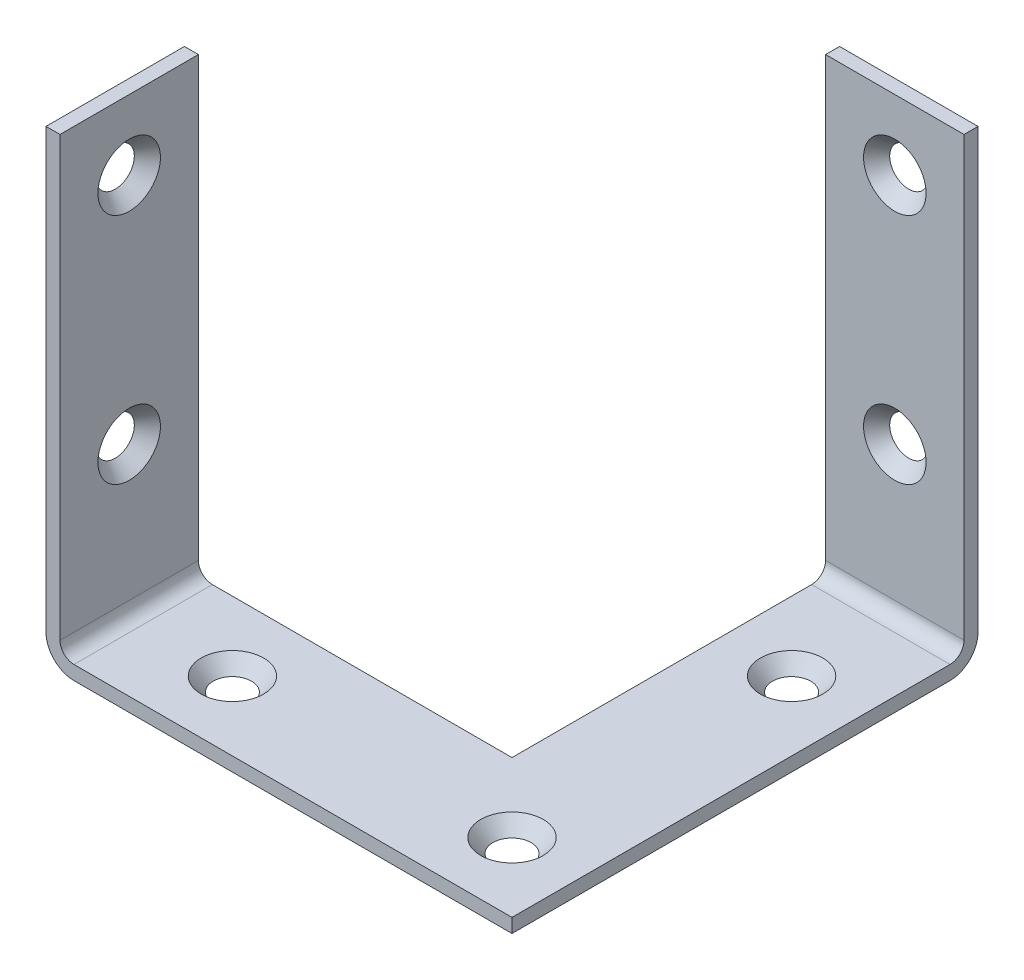
from build123d import *
from OCP.BRepFilletAPI import BRepFilletAPI_MakeChamfer

# Parameters (mm, degrees)
EXTRUDE_THIN1_DEPTH = 7.5438
SKETCH4_R           = 2.0828
CUT_EXTRUDE1_DEPTH  = 72.173542096
SKETCH5_R           = 2.0828
CUT_EXTRUDE2_DEPTH  = 72.173542096
CHAMFER1_SIZE       = 1.324792988
CHAMFER1_SIZE_2     = 1.524
CIRPATTERN1_COUNT   = 2
CIRPATTERN1_ANGLE   = 90


with BuildPart() as part:
    # Sketch1 → Extrude-Thin1 (new, symmetric)
    with BuildSketch(Plane.XY):
        with BuildLine():
            Line((-50.8, 50.8), (-50.8, 3.048))
            ThreePointArc((-50.8, 3.048), (-49.907261469, 0.892738531), (-47.752, 0))
            Line((-47.752, 0), (0, 0))
            Line((0, 0), (0, 1.524))
            Line((0, 1.524), (-47.752, 1.524))
            ThreePointArc((-47.752, 1.524), (-48.829630735, 1.970369265), (-49.276, 3.048))
            Line((-49.276, 3.048), (-49.276, 50.8))
            Line((-49.276, 50.8), (-50.8, 50.8))
        make_face()
    extrude(amount=EXTRUDE_THIN1_DEPTH, both=True)

    # Sketch4 → Cut-Extrude1 (cut, through all)
    with BuildSketch(Plane(origin=(0, 1.524, 0), x_dir=(1, 0, 0), z_dir=(0, 1, 0))):
        with Locations(Location((-7.5438, 0, 0), (0, 0, 270))):
            Circle(SKETCH4_R)
        with Locations(Location((-38.0238, 0, 0), (0, 0, 270))):
            Circle(SKETCH4_R)
    extrude(amount=-CUT_EXTRUDE1_DEPTH, mode=Mode.SUBTRACT)

    # Sketch5 → Cut-Extrude2 (cut, through all)
    with BuildSketch(Plane(origin=(-49.276, 0, 0), x_dir=(0, 0, -1), z_dir=(1, 0, 0))):
        with Locations(Location((0, 43.18, 0), (0, 0, 90))):
            Circle(SKETCH5_R)
        with Locations(Location((0, 17.78, 0), (0, 0, 90))):
            Circle(SKETCH5_R)
    extrude(amount=-CUT_EXTRUDE2_DEPTH, mode=Mode.SUBTRACT)

    # Chamfer1
    chamfer1_edges_1 = [part.edges().sort_by_distance(p)[0] for p in [
        (-7.5438, 1.524, -2.0828),
    ]]
    chamfer1_side_1 = [part.faces().sort_by_distance(p)[0] for p in [
        (-7.5438, 1.524, -2.10929586),
    ]]
    chamfer1_edges_2 = [part.edges().sort_by_distance(p)[0] for p in [
        (-38.0238, 1.524, -2.0828),
    ]]
    chamfer1_side_2 = [part.faces().sort_by_distance(p)[0] for p in [
        (-38.0238, 1.524, -2.10929586),
    ]]
    chamfer1_edges_3 = [part.edges().sort_by_distance(p)[0] for p in [
        (-49.276, 41.0972, 0),
    ]]
    chamfer1_side_3 = [part.faces().sort_by_distance(p)[0] for p in [
        (-49.276, 41.07070414, 0),
    ]]
    chamfer1_edges_4 = [part.edges().sort_by_distance(p)[0] for p in [
        (-49.276, 15.6972, 0),
    ]]
    chamfer1_side_4 = [part.faces().sort_by_distance(p)[0] for p in [
        (-49.276, 15.67070414, 0),
    ]]
    chamfer1 = BRepFilletAPI_MakeChamfer(part.part.solid().wrapped)
    for e in chamfer1_edges_1:
        chamfer1.Add(CHAMFER1_SIZE - 0.0001, CHAMFER1_SIZE_2 - 0.0001, e.wrapped, chamfer1_side_1[0].wrapped)
    for e in chamfer1_edges_2:
        chamfer1.Add(CHAMFER1_SIZE - 0.0001, CHAMFER1_SIZE_2 - 0.0001, e.wrapped, chamfer1_side_2[0].wrapped)
    for e in chamfer1_edges_3:
        chamfer1.Add(CHAMFER1_SIZE - 0.0001, CHAMFER1_SIZE_2 - 0.0001, e.wrapped, chamfer1_side_3[0].wrapped)
    for e in chamfer1_edges_4:
        chamfer1.Add(CHAMFER1_SIZE - 0.0001, CHAMFER1_SIZE_2 - 0.0001, e.wrapped, chamfer1_side_4[0].wrapped)
    add(Compound.cast(chamfer1.Shape()), mode=Mode.REPLACE)  # a hair under: the kernel refuses the full size


with BuildPart() as cirpattern1_1:
    # CirPattern1: pattern copy
    add(part.part.rotate(Axis((-7.5438, 0, 0), (0, -1, 0)), 1 * CIRPATTERN1_ANGLE / (CIRPATTERN1_COUNT - 1)))

    # Combine1: union part
    add(part.part)


solid = cirpattern1_1.part
